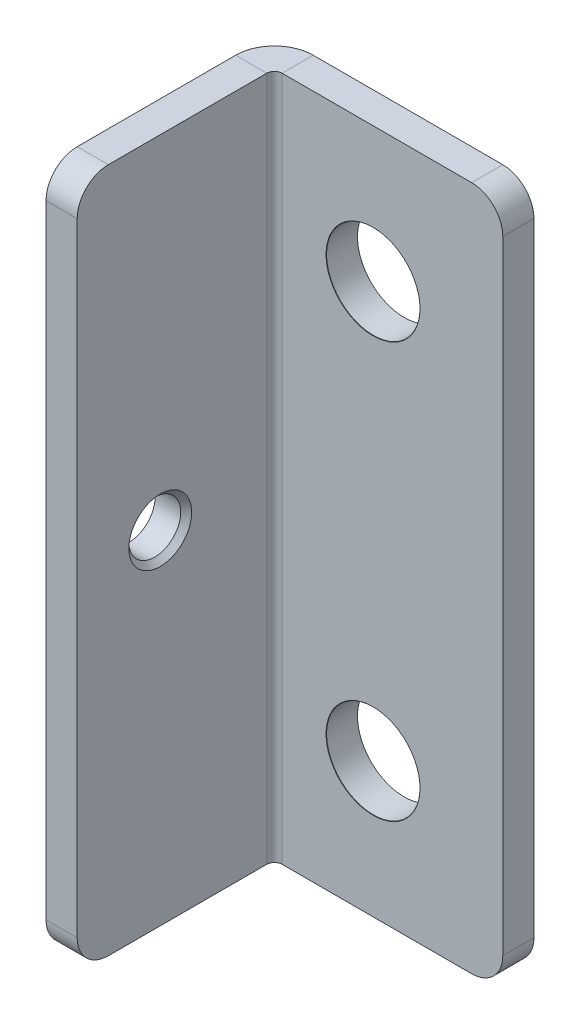
from build123d import *

# Parameters (mm, degrees)
SKETCH_1_W                       = 25
SKETCH_1_H                       = 66
SM_BASE_FLANGE_1_DEPTH           = 3
SM_EDGE_FLANGE_1_STRIP_W         = 13.4732
SM_EDGE_FLANGE_1_STRIP_H         = 3
SM_EDGE_FLANGE_1_STRIP_CUT_DEPTH = 66
SM_EDGE_FLANGE_1_DEPTH           = 66
OTHER_START                      = -12.5
OTHER_1_DEPTH                    = 3
OTHER_START_2                    = -3
OTHER_1_2_DEPTH                  = 3
HOLE_WIZARD_M8_2_D               = 9
HOLE_WIZARD_M8_2_DEPTH           = 24.5
HOLE_WIZARD_M8_2_CSINK_D         = 9.05
HOLE_WIZARD_M8_2_CSINK_ANGLE     = 90
HOLE_WIZARD_M8_2_TIP             = 2.703872786
HOLE_WIZARD_M6_1_D               = 5
HOLE_WIZARD_M6_1_DEPTH           = 15
HOLE_WIZARD_M6_1_CSINK_D         = 6.05
HOLE_WIZARD_M6_1_CSINK_ANGLE     = 90
HOLE_WIZARD_M6_1_TIP             = 1.502151548


# Read off the part's stored shape, not the designer's step: 断开-边角1
# Sheet-metal steps are written as plain solids
with BuildPart() as part:
    # Sketch 1 → 基体-法兰1 (new body)
    with BuildSketch(Plane.XY):
        Rectangle(SKETCH_1_W, SKETCH_1_H)
    extrude(amount=-SM_BASE_FLANGE_1_DEPTH)

    # 边线-法兰1 strip (across the edge) → 边线-法兰1 strip cut (cut)
    with BuildSketch(Plane(origin=(-12.5, 33, 0), x_dir=(1, 0, 0), z_dir=(0, -1, 0))):
        with Locations((-3, -1.5)):
            Rectangle(SM_EDGE_FLANGE_1_STRIP_W, SM_EDGE_FLANGE_1_STRIP_H)
    extrude(amount=SM_EDGE_FLANGE_1_STRIP_CUT_DEPTH, mode=Mode.SUBTRACT)

    # 边线-法兰1 section (across the edge) → 边线-法兰1 (add)
    with BuildSketch(Plane(origin=(-12.5, 33, 0), x_dir=(1, 0, 0), z_dir=(0, -1, 0))):
        with BuildLine():
            Line((0, 0.7366), (0, 19))
            Line((0, 19), (3, 19))
            Line((3, 19), (3, 0.7366))
            ThreePointArc((3, 0.7366), (3.215745145, 0.215745145), (3.7366, 0))
            Line((3.7366, 0), (3.7366, -3))
            ThreePointArc((3.7366, -3), (1.094424801, -1.905575199), (0, 0.7366))
        make_face()
    extrude(amount=SM_EDGE_FLANGE_1_DEPTH)

    # Other 1 outline → Other 1 (cut)
    with BuildSketch(Plane.YZ.offset(OTHER_START)):
        with BuildLine():
            ThreePointArc((-33, 16), (-32.121320344, 18.121320344), (-30, 19))
            Line((-30, 19), (-33, 19))
            Line((-33, 19), (-33, 16))
        make_face()
        with BuildLine():
            ThreePointArc((30, 19), (32.121320344, 18.121320344), (33, 16))
            Line((33, 16), (33, 19))
            Line((33, 19), (30, 19))
        make_face()
    extrude(amount=OTHER_1_DEPTH, mode=Mode.SUBTRACT)

    # Other 1 2 outline → Other 1 2 (cut)
    with BuildSketch(Plane.XY.offset(OTHER_START_2)):
        with BuildLine():
            ThreePointArc((9.5, 33), (11.621320344, 32.121320344), (12.5, 30))
            Line((12.5, 30), (12.5, 33))
            Line((12.5, 33), (9.5, 33))
        make_face()
        with BuildLine():
            ThreePointArc((12.5, -30), (11.621320344, -32.121320344), (9.5, -33))
            Line((9.5, -33), (12.5, -33))
            Line((12.5, -33), (12.5, -30))
        make_face()
    extrude(amount=OTHER_1_2_DEPTH, mode=Mode.SUBTRACT)

    # M8 间隙孔2
    with Locations(Plane.XY):
        with Locations((0, 20), (0, -20)):
            CounterSinkHole(HOLE_WIZARD_M8_2_D / 2, HOLE_WIZARD_M8_2_CSINK_D / 2, depth=HOLE_WIZARD_M8_2_DEPTH, counter_sink_angle=HOLE_WIZARD_M8_2_CSINK_ANGLE)
            with Locations((0, 0, -(HOLE_WIZARD_M8_2_DEPTH + HOLE_WIZARD_M8_2_TIP / 2))):  # 118° drill point
                Cone(0, HOLE_WIZARD_M8_2_D / 2, HOLE_WIZARD_M8_2_TIP, mode=Mode.SUBTRACT)

    # M6 螺纹孔1
    with Locations(Plane(origin=(-9.5, 0, 0), x_dir=(0, 0, -1), z_dir=(1, 0, 0))):
        with Locations((-11, 0)):
            CounterSinkHole(HOLE_WIZARD_M6_1_D / 2, HOLE_WIZARD_M6_1_CSINK_D / 2, depth=HOLE_WIZARD_M6_1_DEPTH, counter_sink_angle=HOLE_WIZARD_M6_1_CSINK_ANGLE)
            with Locations((0, 0, -(HOLE_WIZARD_M6_1_DEPTH + HOLE_WIZARD_M6_1_TIP / 2))):  # 118° drill point
                Cone(0, HOLE_WIZARD_M6_1_D / 2, HOLE_WIZARD_M6_1_TIP, mode=Mode.SUBTRACT)


solid = part.part
